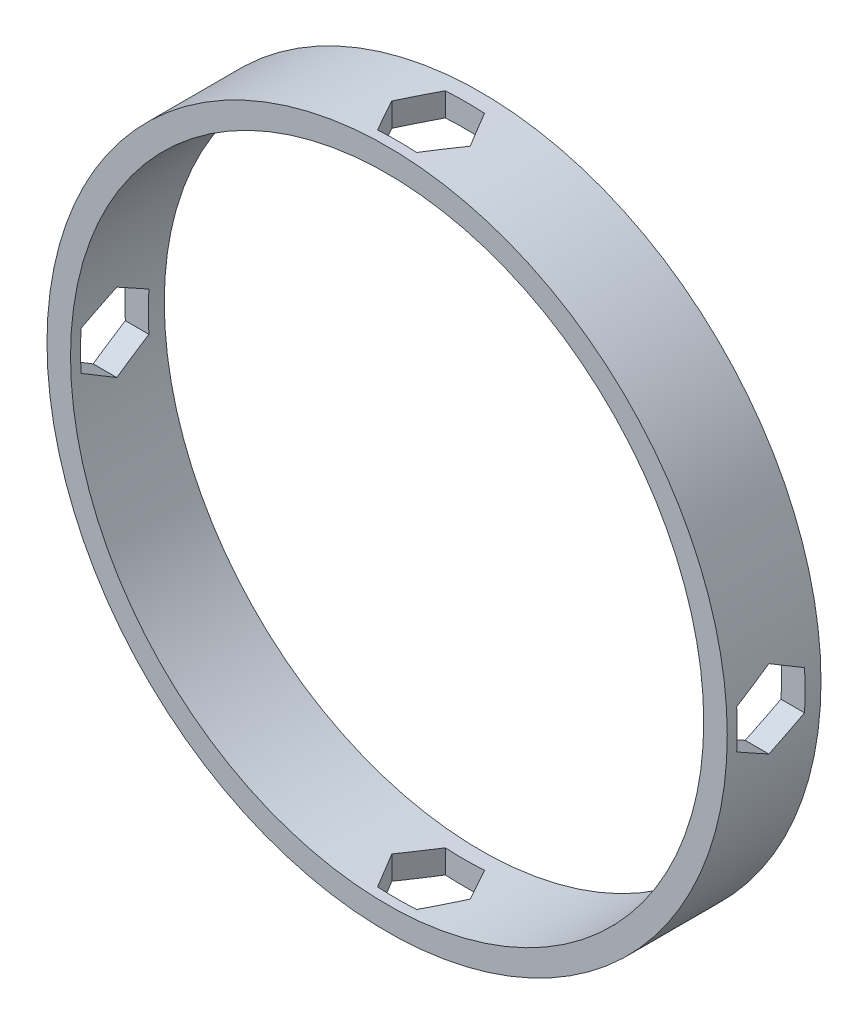
from build123d import *

# Parameters (mm, degrees)
SKETCH1_R           = 34.11
SKETCH1_R_2         = 31.75
BOSS_EXTRUDE1_DEPTH = 9.4
CUT_EXTRUDE1_DEPTH  = 77.849336367
CIRPATTERN2_COUNT   = 2
CIRPATTERN2_ANGLE   = 90


with BuildPart() as part:
    # Sketch1 → Boss-Extrude1 (new body)
    with BuildSketch(Plane.XY):
        Circle(SKETCH1_R)
        Circle(SKETCH1_R_2, mode=Mode.SUBTRACT)
    extrude(amount=BOSS_EXTRUDE1_DEPTH)

    # Sketch2 → Cut-Extrude1 (cut, through all)
    with BuildSketch(Plane(origin=(0, 34.11, 0), x_dir=(1, 0, 0), z_dir=(0, 1, 0))):
        Polygon((3.92598183, -5), (1.962990915, -1.6), (-1.962990915, -1.6), (-3.92598183, -5), (-1.962990915, -8.4), (1.962990915, -8.4), align=None)
    cut_extrude1 = extrude(amount=-CUT_EXTRUDE1_DEPTH, mode=Mode.SUBTRACT)

    # CirPattern2: Cut-Extrude1 ×2 about axis
    cirpattern2_axis = Axis((0, 0, 9.4), (0, 0, 1))
    for i in range(1, CIRPATTERN2_COUNT):
        add(cut_extrude1.rotate(cirpattern2_axis, i * CIRPATTERN2_ANGLE / (CIRPATTERN2_COUNT - 1)), mode=Mode.SUBTRACT)


solid = part.part
